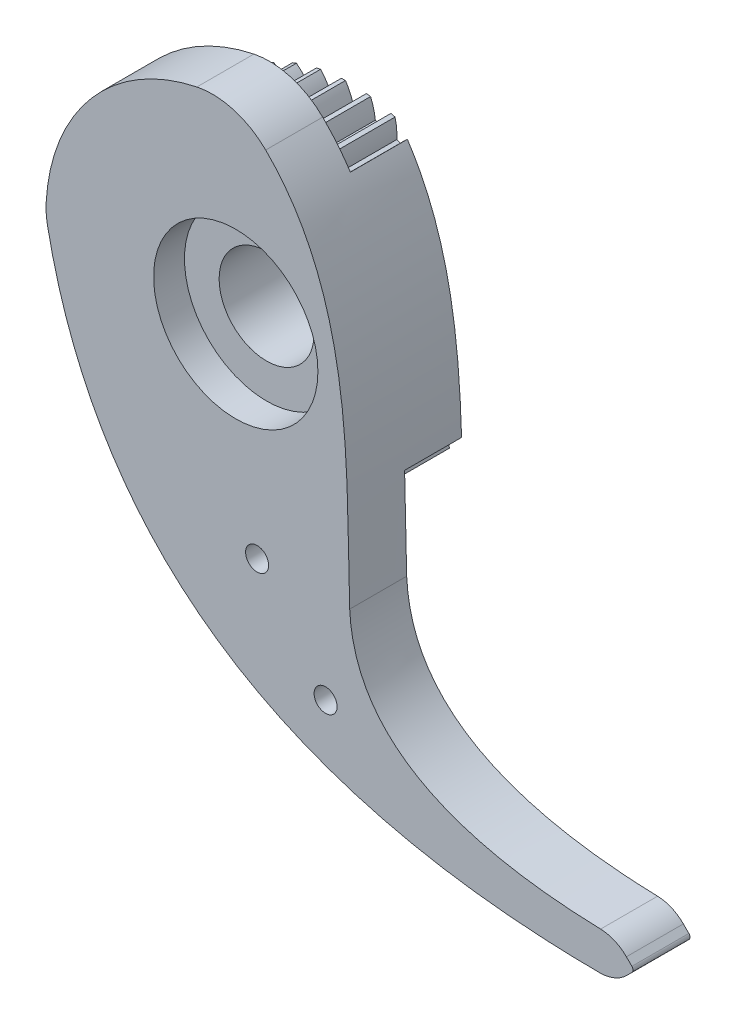
from build123d import *

# Parameters (mm, degrees)
CROQUIS1_R              = 10
SALIENTE_EXTRUIR1_DEPTH = 100
CORTAR_EXTRUIR4_DEPTH   = 15
CROQUIS6_W              = 251.16953667
CROQUIS6_H              = 379.695084619
CORTAR_EXTRUIR6_DEPTH   = 70
CAVIDAD1_START          = 15
CAVIDAD1_DEPTH          = 9.15
CAVIDAD1_START_2        = 24.15
CAVIDAD1_2_OUTLINE_R    = 3.03
CAVIDAD1_2_DEPTH        = 5.85
CROQUIS7_R              = 12.5
CORTAR_EXTRUIR7_DEPTH   = 30
CROQUIS8_R              = 21
CORTAR_EXTRUIR8_DEPTH   = 8
CORTAR_EXTRUIR9_START   = -8
CROQUIS9_R              = 21
CORTAR_EXTRUIR9_DEPTH   = 8
SALIENTE_EXTRUIR2_START = 8
CROQUIS10_R             = 21
CROQUIS10_R_2           = 12.5
SALIENTE_EXTRUIR2_DEPTH = 8
CAVIDAD2_START          = 21.88
CAVIDAD2_OUTLINE_R      = 21.63
CAVIDAD2_DEPTH          = 8.12


# Read off the part's stored shape, not the designer's step: Cavidad1, Cavidad2
with BuildPart() as part:
    # Croquis1 → Saliente-Extruir1 (new body)
    with BuildSketch(Plane.XY):
        with BuildLine():
            Line((102.84709295, -92.84709295), (104.292893219, -94.292893219))
            ThreePointArc((104.292893219, -94.292893219), (104.585786438, -95), (104.292893219, -95.707106781))
            Line((104.292893219, -95.707106781), (102.924090823, -97.075909177))
            ThreePointArc((102.924090823, -97.075909177), (99.655924863, -99.253513567), (95.801242309, -100.004707302))
            add(Edge.make_bspline(
                [(-49.58600728, -2.205776949), (-47.044709507, -15.23286343), (-27.045253615, -73.563310407), (28.636670051, -99.656919769), (95.801242309, -100.004707302)],
                knots=[0.011039812, 0.011039812, 0.011039812, 0.011039812, 0.207725041, 0.983937689, 0.983937689, 0.983937689, 0.983937689], degree=3))
            ThreePointArc((-49.58600728, -2.205776949), (-49.90808847, 0.239585929), (-49.92672205, 2.705998037))
            ThreePointArc((-49.92672205, 2.705998037), (-37.935964584, 32.570885635), (-10.229250857, 48.942439936))
            ThreePointArc((-10.229250857, 48.942439936), (-0.503550938, 48.555514737), (7.88775097, 43.623476385))
            add(Edge.make_bspline(
                [(30, -50), (29.065577858, -23.91659264), (31.451883129, 15.353668912), (10.5535399, 41.001196903), (7.88775097, 43.623476385)],
                knots=[0, 0, 0, 0, 0.805376889, 0.908560603, 0.908560603, 0.908560603, 0.908560603], degree=3))
            add(Edge.make_bspline(
                [(96.061432126, -89.922234449), (74.639632489, -89.310592156), (42.207594165, -82.045244121), (30.598677739, -62.69576919), (30, -50)],
                knots=[0.027764728, 0.027764728, 0.027764728, 0.027764728, 0.487449894, 0.947135059, 0.947135059, 0.947135059, 0.947135059], degree=3))
            ThreePointArc((96.061432126, -89.922234449), (99.734323975, -90.734922209), (102.84709295, -92.84709295))
        make_face()
        Circle(CROQUIS1_R, mode=Mode.SUBTRACT)
    extrude(amount=SALIENTE_EXTRUIR1_DEPTH)

    # Croquis2 → Cortar-Extruir4 (cut)
    with BuildSketch(Plane(origin=(0, 0, 0), x_dir=(-1, 0, 0), z_dir=(0, 0, -1))):
        with BuildLine():
            ThreePointArc((1.102623365, 39.984799883), (1.653330869, 39.965816607), (2.203724614, 39.939248839))
            ThreePointArc((2.203724614, 39.939248839), (3.208029629, 37.678468026), (3.853201686, 35.290265468))
            ThreePointArc((3.853201686, 35.290265468), (4.391380959, 35.227344113), (4.928537187, 35.156215968))
            ThreePointArc((4.928537187, 35.156215968), (6.140272041, 37.312939662), (7.668866774, 39.257973488))
            ThreePointArc((7.668866774, 39.257973488), (8.208938801, 39.148605643), (8.747452981, 39.031808392))
            ThreePointArc((8.747452981, 39.031808392), (9.365948293, 36.63655851), (9.609235823, 34.174736091))
            ThreePointArc((9.609235823, 34.174736091), (10.129718517, 34.024091505), (10.647841327, 33.865520446))
            ThreePointArc((10.647841327, 33.865520446), (12.198034749, 35.793384238), (14.025923488, 37.460291914))
            ThreePointArc((14.025923488, 37.460291914), (14.540628281, 37.263522769), (15.052573634, 37.05968196))
            ThreePointArc((15.052573634, 37.05968196), (15.268388303, 34.595299183), (15.103155055, 32.127009001))
            ThreePointArc((15.103155055, 32.127009001), (15.591743761, 31.892750375), (16.076700112, 31.651061807))
            ThreePointArc((16.076700112, 31.651061807), (17.923066867, 33.297478598), (20.000389573, 34.640791229))
            ThreePointArc((20.000389573, 34.640791229), (20.475687326, 34.361988134), (20.947099317, 34.076664012))
            ThreePointArc((20.947099317, 34.076664012), (20.754346482, 31.610370276), (20.18509959, 29.202940855))
            ThreePointArc((20.18509959, 29.202940855), (20.628466879, 28.891458153), (21.067028427, 28.57324471))
            ThreePointArc((21.067028427, 28.57324471), (23.159204443, 29.893304542), (25.429297167, 30.87638006))
            ThreePointArc((25.429297167, 30.87638006), (25.852222997, 30.523148037), (26.270242736, 30.164123501))
            ThreePointArc((26.270242736, 30.164123501), (25.674180192, 27.763192871), (24.716447225, 25.482292608))
            ThreePointArc((24.716447225, 25.482292608), (25.102499195, 25.102082267), (25.482703124, 24.716023982))
            ThreePointArc((25.482703124, 24.716023982), (27.763619294, 25.673719065), (30.164559823, 26.269741732))
            ThreePointArc((30.164559823, 26.269741732), (30.523577417, 25.85171603), (30.876802415, 25.428784332))
            ThreePointArc((30.876802415, 25.428784332), (29.893689193, 23.158707937), (28.573594612, 21.066553846))
            ThreePointArc((28.573594612, 21.066553846), (28.891800771, 20.627987013), (29.203276108, 20.18461455))
            ThreePointArc((29.203276108, 20.18461455), (31.610714984, 20.753821458), (34.077011921, 20.94653333))
            ThreePointArc((34.077011921, 20.94653333), (34.362328213, 20.4751166), (34.641123413, 19.999814215))
            ThreePointArc((34.641123413, 19.999814215), (33.297776281, 17.922513822), (31.651328823, 16.076174412))
            ThreePointArc((31.651328823, 16.076174412), (31.893009337, 15.591214047), (32.127259848, 15.102621451))
            ThreePointArc((32.127259848, 15.102621451), (34.595552773, 15.267813702), (37.059931966, 15.051958102))
            ThreePointArc((37.059931966, 15.051958102), (37.263764272, 14.540009363), (37.460524868, 14.025301302))
            ThreePointArc((37.460524868, 14.025301302), (35.793586832, 12.197440249), (33.865697293, 10.647278847))
            ThreePointArc((33.865697293, 10.647278847), (34.024259747, 10.129153404), (34.174895688, 9.608668207))
            ThreePointArc((34.174895688, 9.608668207), (36.636714066, 9.365339789), (39.031953674, 8.746804694))
            ThreePointArc((39.031953674, 8.746804694), (39.148741981, 8.208288574), (39.258100856, 7.668214731))
            ThreePointArc((39.258100856, 7.668214731), (37.313041641, 6.139652303), (35.156297822, 4.927953271))
            ThreePointArc((35.156297822, 4.927953271), (35.227417046, 4.390795861), (35.290329461, 3.852615543))
            ThreePointArc((35.290329461, 3.852615543), (37.678521304, 3.20740382), (39.939285436, 2.203061256))
            ThreePointArc((39.939285436, 2.203061256), (39.965844062, 1.65266707), (39.984818192, 1.101959251))
            ThreePointArc((39.984818192, 1.101959251), (37.814693942, -0.085609353), (35.487926192, -0.925794025))
            ThreePointArc((35.487926192, -0.925794025), (35.469662238, -1.467331147), (35.443135042, -2.00852643))
            ThreePointArc((35.443135042, -2.00852643), (37.692556701, -3.038021764), (39.757177604, -4.400775951))
            ThreePointArc((39.757177604, -4.400775951), (39.692782099, -4.948034883), (39.620853919, -5.494354805))
            ThreePointArc((39.620853919, -5.494354805), (37.284859968, -6.308535809), (34.851536446, -6.754288072))
            ThreePointArc((34.851536446, -6.754288072), (34.744387508, -7.285433186), (34.629144292, -7.814881038))
            ThreePointArc((34.629144292, -7.814881038), (36.678437409, -9.200578033), (38.490597607, -10.884571461))
            ThreePointArc((38.490597607, -10.884571461), (38.337004513, -11.413767343), (38.176136036, -11.940797184))
            ThreePointArc((38.176136036, -11.940797184), (35.737992209, -12.359381853), (33.264487636, -12.398542748))
            ThreePointArc((33.264487636, -12.398542748), (33.071376458, -12.904807599), (32.870560757, -13.408066063))
            ThreePointArc((32.870560757, -13.408066063), (34.663825958, -15.112166519), (36.174094444, -17.071464236))
            ThreePointArc((36.174094444, -17.071464236), (35.935493381, -17.568161984), (35.690072679, -18.061525743))
            ThreePointArc((35.690072679, -18.061525743), (33.216285184, -18.073096179), (30.770070318, -17.704597499))
            ThreePointArc((30.770070318, -17.704597499), (30.496264469, -18.172172502), (30.215354012, -18.635513998))
            ThreePointArc((30.215354012, -18.635513998), (31.703675696, -20.611534496), (32.870856284, -22.792691969))
            ThreePointArc((32.870856284, -22.792691969), (32.553755666, -23.243342962), (32.230477177, -23.689582963))
            ThreePointArc((32.230477177, -23.689582963), (29.788524487, -23.293823554), (27.436325694, -22.527716982))
            ThreePointArc((27.436325694, -22.527716982), (27.089293883, -22.94384791), (26.735951175, -23.35463369))
            ThreePointArc((26.735951175, -23.35463369), (27.878731807, -25.548673542), (28.670986852, -27.89219448))
            ThreePointArc((28.670986852, -27.89219448), (28.284036357, -28.284506136), (27.891718275, -28.671450114))
            ThreePointArc((27.891718275, -28.671450114), (25.548210496, -27.879156145), (23.354189625, -26.736339072))
            ThreePointArc((23.354189625, -26.736339072), (22.943397976, -27.089674957), (22.527261285, -27.436699856))
            ThreePointArc((22.527261285, -27.436699856), (23.293328789, -29.788911374), (23.689047639, -32.230870636))
            ThreePointArc((23.689047639, -32.230870636), (23.242802268, -32.554141714), (22.792146008, -32.871234847))
            ThreePointArc((22.792146008, -32.871234847), (20.611007921, -31.704018032), (18.635012143, -30.215663528))
            ThreePointArc((18.635012143, -30.215663528), (18.171665982, -30.496566289), (17.704086432, -30.770364373))
            ThreePointArc((17.704086432, -30.770364373), (18.072544482, -33.216585358), (18.060932958, -35.690372661))
            ThreePointArc((18.060932958, -35.690372661), (17.567565123, -35.935785168), (17.070863412, -36.174377982))
            ThreePointArc((17.070863412, -36.174377982), (15.111590779, -34.664076954), (13.407520108, -32.870783449))
            ThreePointArc((13.407520108, -32.870783449), (12.90425831, -33.071590791), (12.397990251, -33.264693561))
            ThreePointArc((12.397990251, -33.264693561), (12.358788274, -35.738197483), (11.940163108, -38.176334357))
            ThreePointArc((11.940163108, -38.176334357), (11.413130596, -38.337194081), (10.883932163, -38.490778385))
            ThreePointArc((10.883932163, -38.490778385), (9.199968834, -36.678590218), (7.814305875, -34.629274085))
            ThreePointArc((7.814305875, -34.629274085), (7.28485611, -34.744508508), (6.753709216, -34.851648624))
            ThreePointArc((6.753709216, -34.851648624), (6.307916538, -37.284964743), (5.493696735, -39.62094517))
            ThreePointArc((5.493696735, -39.62094517), (4.947375618, -39.692864277), (4.400115616, -39.757250692))
            ThreePointArc((4.400115616, -39.757250692), (3.037395721, -37.692607155), (2.007937749, -35.443168397))
            ThreePointArc((2.007937749, -35.443168397), (1.466742025, -35.469686605), (0.9252046, -35.487941564))
            ThreePointArc((0.9252046, -35.487941564), (0.084981283, -37.814695359), (-1.102623365, -39.984799883))
            ThreePointArc((-1.102623365, -39.984799883), (-1.653330869, -39.965816607), (-2.203724614, -39.939248839))
            ThreePointArc((-2.203724614, -39.939248839), (-3.208029629, -37.678468026), (-3.853201686, -35.290265468))
            ThreePointArc((-3.853201686, -35.290265468), (-4.391380959, -35.227344113), (-4.928537187, -35.156215968))
            ThreePointArc((-4.928537187, -35.156215968), (-6.140272041, -37.312939662), (-7.668866774, -39.257973488))
            ThreePointArc((-7.668866774, -39.257973488), (-8.208938801, -39.148605643), (-8.747452981, -39.031808392))
            ThreePointArc((-8.747452981, -39.031808392), (-9.365948293, -36.63655851), (-9.609235823, -34.174736091))
            ThreePointArc((-9.609235823, -34.174736091), (-10.129718517, -34.024091505), (-10.647841327, -33.865520446))
            ThreePointArc((-10.647841327, -33.865520446), (-12.198034749, -35.793384238), (-14.025923488, -37.460291914))
            ThreePointArc((-14.025923488, -37.460291914), (-14.540628281, -37.263522769), (-15.052573634, -37.05968196))
            ThreePointArc((-15.052573634, -37.05968196), (-15.268388303, -34.595299183), (-15.103155055, -32.127009001))
            ThreePointArc((-15.103155055, -32.127009001), (-15.591743761, -31.892750375), (-16.076700112, -31.651061807))
            ThreePointArc((-16.076700112, -31.651061807), (-17.923066867, -33.297478598), (-20.000389573, -34.640791229))
            ThreePointArc((-20.000389573, -34.640791229), (-20.475687326, -34.361988134), (-20.947099317, -34.076664012))
            ThreePointArc((-20.947099317, -34.076664012), (-20.754346482, -31.610370276), (-20.18509959, -29.202940855))
            ThreePointArc((-20.18509959, -29.202940855), (-20.628466879, -28.891458153), (-21.067028427, -28.57324471))
            ThreePointArc((-21.067028427, -28.57324471), (-23.159204443, -29.893304542), (-25.429297167, -30.87638006))
            ThreePointArc((-25.429297167, -30.87638006), (-25.852222997, -30.523148037), (-26.270242736, -30.164123501))
            ThreePointArc((-26.270242736, -30.164123501), (-25.674180192, -27.763192871), (-24.716447225, -25.482292608))
            ThreePointArc((-24.716447225, -25.482292608), (-25.102499195, -25.102082267), (-25.482703124, -24.716023982))
            ThreePointArc((-25.482703124, -24.716023982), (-27.421409872, -25.555856409), (-29.453588357, -26.133916065))
            add(Edge.make_bspline(
                [(-30, -50), (-29.734872846, -42.599255467), (-29.715262914, -34.495945215), (-29.453588357, -26.133916065)],
                knots=[0, 0, 0, 0, 0.228512653, 0.228512653, 0.228512653, 0.228512653], degree=3))
            add(Edge.make_bspline(
                [(-96.061432126, -89.922234449), (-74.639632489, -89.310592156), (-42.207594165, -82.045244121), (-30.598677739, -62.69576919), (-30, -50)],
                knots=[0.027764728, 0.027764728, 0.027764728, 0.027764728, 0.487449894, 0.947135059, 0.947135059, 0.947135059, 0.947135059], degree=3))
            ThreePointArc((-96.061432126, -89.922234449), (-99.734323975, -90.734922209), (-102.84709295, -92.84709295))
            Line((-102.84709295, -92.84709295), (-104.292893219, -94.292893219))
            ThreePointArc((-104.292893219, -94.292893219), (-104.585786438, -95), (-104.292893219, -95.707106781))
            Line((-104.292893219, -95.707106781), (-102.924090823, -97.075909177))
            ThreePointArc((-102.924090823, -97.075909177), (-99.655924863, -99.253513567), (-95.801242309, -100.004707302))
            add(Edge.make_bspline(
                [(49.58600728, -2.205776949), (47.044709507, -15.23286343), (27.045253615, -73.563310407), (-28.636670051, -99.656919769), (-95.801242309, -100.004707302)],
                knots=[0.011039812, 0.011039812, 0.011039812, 0.011039812, 0.207725041, 0.983937689, 0.983937689, 0.983937689, 0.983937689], degree=3))
            ThreePointArc((49.58600728, -2.205776949), (49.90808847, 0.239585929), (49.92672205, 2.705998037))
            ThreePointArc((49.92672205, 2.705998037), (37.935964584, 32.570885635), (10.229250857, 48.942439936))
            ThreePointArc((10.229250857, 48.942439936), (0.503550938, 48.555514737), (-7.88775097, 43.623476385))
            add(Edge.make_bspline(
                [(-15.182020199, 34.727214957), (-15.121605489, 34.818294405), (-12.99668952, 38.002837294), (-10.5535399, 41.001196903), (-7.88775097, 43.623476385)],
                knots=[0.802344073, 0.802344073, 0.802344073, 0.802344073, 0.805376889, 0.908560603, 0.908560603, 0.908560603, 0.908560603], degree=3))
            ThreePointArc((-15.182020199, 34.727214957), (-14.257602386, 33.834526615), (-13.407520108, 32.870783449))
            ThreePointArc((-13.407520108, 32.870783449), (-12.90425831, 33.071590791), (-12.397990251, 33.264693561))
            ThreePointArc((-12.397990251, 33.264693561), (-12.358788274, 35.738197483), (-11.940163108, 38.176334357))
            ThreePointArc((-11.940163108, 38.176334357), (-11.413130596, 38.337194081), (-10.883932163, 38.490778385))
            ThreePointArc((-10.883932163, 38.490778385), (-9.199968834, 36.678590218), (-7.814305875, 34.629274085))
            ThreePointArc((-7.814305875, 34.629274085), (-7.28485611, 34.744508508), (-6.753709216, 34.851648624))
            ThreePointArc((-6.753709216, 34.851648624), (-6.307916538, 37.284964743), (-5.493696735, 39.62094517))
            ThreePointArc((-5.493696735, 39.62094517), (-4.947375618, 39.692864277), (-4.400115616, 39.757250692))
            ThreePointArc((-4.400115616, 39.757250692), (-3.037395721, 37.692607155), (-2.007937749, 35.443168397))
            ThreePointArc((-2.007937749, 35.443168397), (-1.466742025, 35.469686605), (-0.9252046, 35.487941564))
            ThreePointArc((-0.9252046, 35.487941564), (-0.084981283, 37.814695359), (1.102623365, 39.984799883))
        make_face()
    extrude(amount=-CORTAR_EXTRUIR4_DEPTH, mode=Mode.SUBTRACT)

    # Croquis6 → Cortar-Extruir6 (cut)
    with BuildSketch(Plane.XY.offset(100)):
        with Locations((7.868696645, -20.070047355)):
            Rectangle(CROQUIS6_W, CROQUIS6_H)
    extrude(amount=-CORTAR_EXTRUIR6_DEPTH, mode=Mode.SUBTRACT)

    # Cavidad1 outline → Cavidad1 (cut)
    with BuildSketch(Plane.XY.offset(CAVIDAD1_START)):
        Polygon((5.355014557, -56.526622248), (10.533194498, -53.84524465), (10.800143352, -48.020120476), (5.888912264, -44.8763739), (0.710732322, -47.557751499), (0.443783468, -53.382875673), align=None)
        Polygon((25.270793802, -79.515653596), (29.312393262, -75.312225574), (27.692917543, -69.710383759), (22.031842363, -68.311969965), (17.990242902, -72.515397986), (19.609718622, -78.117239802), align=None)
    extrude(amount=CAVIDAD1_DEPTH, mode=Mode.SUBTRACT)

    # Cavidad1 2 outline → Cavidad1 2 (cut)
    with BuildSketch(Plane.XY.offset(CAVIDAD1_START_2)):
        with Locations((5.62196341, -50.701498074)):
            Circle(CAVIDAD1_2_OUTLINE_R)
        with Locations((23.651318082, -73.91381178)):
            Circle(CAVIDAD1_2_OUTLINE_R)
    extrude(amount=CAVIDAD1_2_DEPTH, mode=Mode.SUBTRACT)

    # Croquis7 → Cortar-Extruir7 (cut)
    with BuildSketch(Plane(origin=(0, 0, 0), x_dir=(-1, 0, 0), z_dir=(0, 0, -1))):
        Circle(CROQUIS7_R)
    extrude(amount=-CORTAR_EXTRUIR7_DEPTH, mode=Mode.SUBTRACT)

    # Croquis8 → Cortar-Extruir8 (cut)
    with BuildSketch(Plane(origin=(0, 0, 0), x_dir=(-1, 0, 0), z_dir=(0, 0, -1))):
        Circle(CROQUIS8_R)
    extrude(amount=-CORTAR_EXTRUIR8_DEPTH, mode=Mode.SUBTRACT)

    # Croquis9 → Cortar-Extruir9 (cut)
    with BuildSketch(Plane.XY.offset(30).offset(CORTAR_EXTRUIR9_START)):
        with Locations(Location((0, 0, 0), (0, 0, 180))):
            Circle(CROQUIS9_R)
    extrude(amount=CORTAR_EXTRUIR9_DEPTH, mode=Mode.SUBTRACT)

    # Croquis10 → Saliente-Extruir2 (add)
    with BuildSketch(Plane(origin=(0, 0, 8), x_dir=(-1, 0, 0), z_dir=(0, 0, -1)).offset(SALIENTE_EXTRUIR2_START)):
        with Locations(Location((0, 0, 0), (0, 0, 180))):
            Circle(CROQUIS10_R)
        Circle(CROQUIS10_R_2, mode=Mode.SUBTRACT)
    extrude(amount=-SALIENTE_EXTRUIR2_DEPTH)

    # Cavidad2 outline → Cavidad2 (cut)
    with BuildSketch(Plane.XY.offset(CAVIDAD2_START)):
        Circle(CAVIDAD2_OUTLINE_R)
    extrude(amount=CAVIDAD2_DEPTH, mode=Mode.SUBTRACT)


solid = part.part
